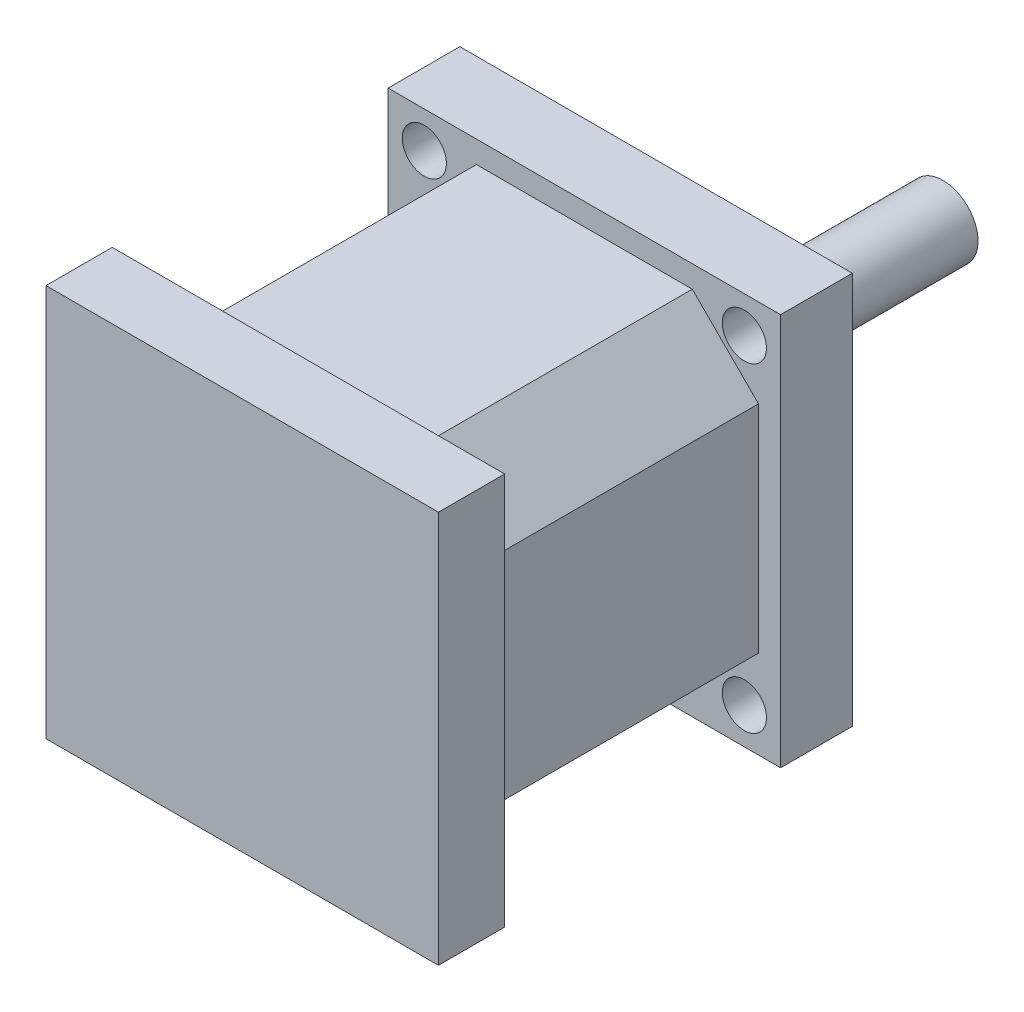
from build123d import *

# Parameters (mm, degrees)
SKETCH1_W           = 35.56
SKETCH1_H           = 35.56
BOSS_EXTRUDE1_DEPTH = 4.5
SKETCH2_W           = 35.56
SKETCH2_H           = 35.56
BOSS_EXTRUDE2_DEPTH = 2
SKETCH5_R           = 11
BOSS_EXTRUDE5_DEPTH = 2
SKETCH6_R           = 3.175
BOSS_EXTRUDE6_DEPTH = 24
SKETCH7_R           = 2
CUT_EXTRUDE3_DEPTH  = 29
SKETCH8_W           = 31.56
SKETCH8_H           = 31.56
BOSS_EXTRUDE7_DEPTH = 25
SKETCH9_W           = 35.56
SKETCH9_H           = 35.56
BOSS_EXTRUDE8_DEPTH = 6
CHAMFER1_SIZE       = 6


with BuildPart() as part:
    # Sketch1 → Boss-Extrude1 (new body)
    with BuildSketch(Plane.XY):
        with Locations((21.15, 20.624391857)):
            Rectangle(SKETCH1_W, SKETCH1_H)
    extrude(amount=BOSS_EXTRUDE1_DEPTH)

    # Sketch2 → Boss-Extrude2 (add)
    with BuildSketch(Plane.XY.offset(4.5)):
        with Locations((21.15, 20.624391857)):
            Rectangle(SKETCH2_W, SKETCH2_H)
    extrude(amount=BOSS_EXTRUDE2_DEPTH)

    # Sketch5 → Boss-Extrude5 (add)
    with BuildSketch(Plane(origin=(0, 0, 0), x_dir=(-1, 0, 0), z_dir=(0, 0, -1))):
        with Locations((-21.15, 20.624391857)):
            Circle(SKETCH5_R)
    extrude(amount=BOSS_EXTRUDE5_DEPTH)

    # Sketch6 → Boss-Extrude6 (add)
    with BuildSketch(Plane(origin=(0, 0, -2), x_dir=(-1, 0, 0), z_dir=(0, 0, -1))):
        with Locations((-21.15, 20.624391857)):
            Circle(SKETCH6_R)
    extrude(amount=BOSS_EXTRUDE6_DEPTH)

    # Sketch7 → Cut-Extrude3 (cut)
    with BuildSketch(Plane(origin=(0, 0, 0), x_dir=(-1, 0, 0), z_dir=(0, 0, -1))):
        with Locations((-35.65, 6.124391857)):
            Circle(SKETCH7_R)
        with Locations((-6.65, 6.124391857)):
            Circle(SKETCH7_R)
        with Locations((-6.65, 35.124391857)):
            Circle(SKETCH7_R)
        with Locations((-35.65, 35.124391857)):
            Circle(SKETCH7_R)
    extrude(amount=-CUT_EXTRUDE3_DEPTH, mode=Mode.SUBTRACT)

    # Sketch8 → Boss-Extrude7 (add)
    with BuildSketch(Plane.XY.offset(6.5)):
        with Locations((21.15, 20.624391857)):
            Rectangle(SKETCH8_W, SKETCH8_H)
    extrude(amount=BOSS_EXTRUDE7_DEPTH)

    # Sketch9 → Boss-Extrude8 (add)
    with BuildSketch(Plane.XY.offset(31.5)):
        with Locations((21.15, 20.624391857)):
            Rectangle(SKETCH9_W, SKETCH9_H)
    extrude(amount=BOSS_EXTRUDE8_DEPTH)

    # Chamfer1
    # the kernel refuses this chamfer: 6 mm, written as the material it takes off along each edge
    with BuildSketch(Plane(origin=(5.37, 36.404391857, 6.5), x_dir=(0.9996219169112968, 0.02749587661058678, 0), z_dir=(0, 0, 1)), Plane(origin=(36.93, 4.844391857, 6.5), x_dir=(-0.9996219169112969, -0.027495876610586355, 0), z_dir=(0, 0, 1)), Plane(origin=(36.93, 36.404391857, 6.5), x_dir=(0.02749587661058678, -0.9996219169112968, 0), z_dir=(0, 0, 1))) as chamfer1_piece_1:
        Polygon((CHAMFER1_SIZE * 0.999621916911, -CHAMFER1_SIZE * 0.0274958766106), (-CHAMFER1_SIZE * 0.0274958766106, -CHAMFER1_SIZE * 0.999621916911), (0, 0), align=None)
    extrude(amount=25, mode=Mode.SUBTRACT)
    with BuildSketch(Plane(origin=(5.37, 4.844391857, 6.5), x_dir=(0.9996219169112969, -0.027495876610586348, 0), z_dir=(0, 0, 1))) as chamfer1_piece_2:
        Polygon((CHAMFER1_SIZE * 0.999621916911, CHAMFER1_SIZE * 0.0274958766106), (-CHAMFER1_SIZE * 0.0274958766106, CHAMFER1_SIZE * 0.999621916911), (0, 0), align=None)
    extrude(amount=25, mode=Mode.SUBTRACT)


solid = part.part
